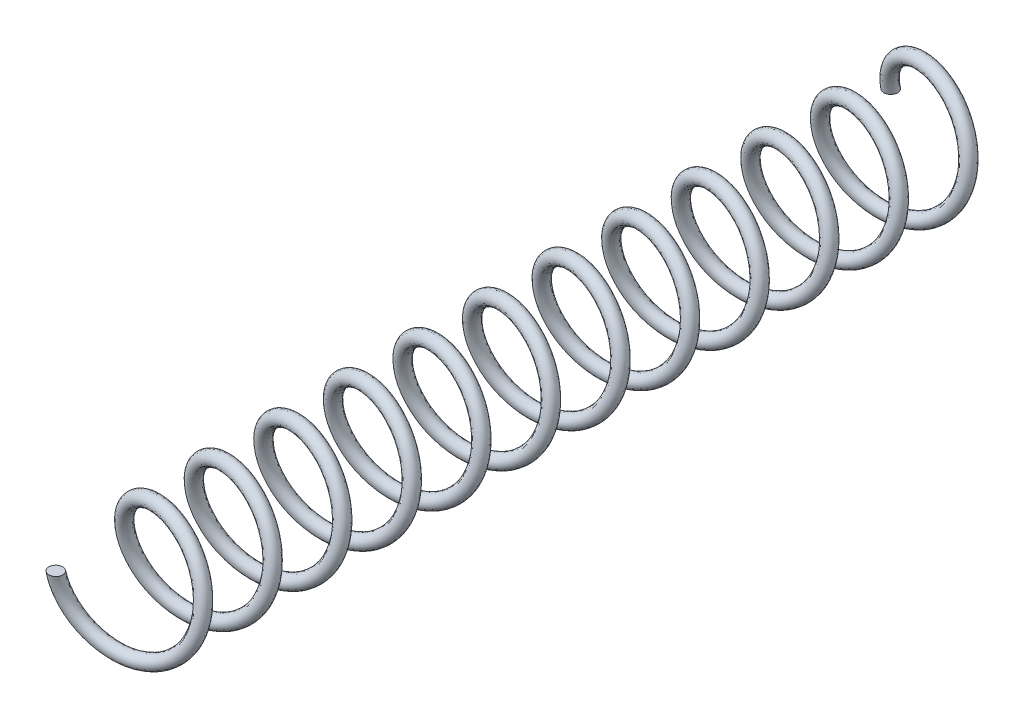
from build123d import *

# Parameters (mm, degrees)
SWEEP_2_PITCH       = 5
SWEEP_2_HEIGHT      = 60
SWEEP_2_RADIUS      = 4
SWEEP_2_START_ANGLE = -180
SKETCH_3_R          = 0.5


with BuildPart() as part:
    # 扫描2: sweep along a helix
    with BuildLine() as sweep_2_path:
        add(Helix(SWEEP_2_PITCH, SWEEP_2_HEIGHT, SWEEP_2_RADIUS, center=(0, 0, 0), direction=(0, 0, 1), lefthand=True, mode=Mode.PRIVATE).rotate(Axis((0, 0, 0), (0, 0, 1)), SWEEP_2_START_ANGLE))
    # 草图3 → 扫描2 (sweep)
    with BuildSketch(Plane(origin=(0, 0, 0), x_dir=(1, 0, 0), z_dir=(0, 1, 0))):
        with Locations((-4, 0)):
            Circle(SKETCH_3_R)
    sweep(path=sweep_2_path.line, is_frenet=True)


solid = part.part
